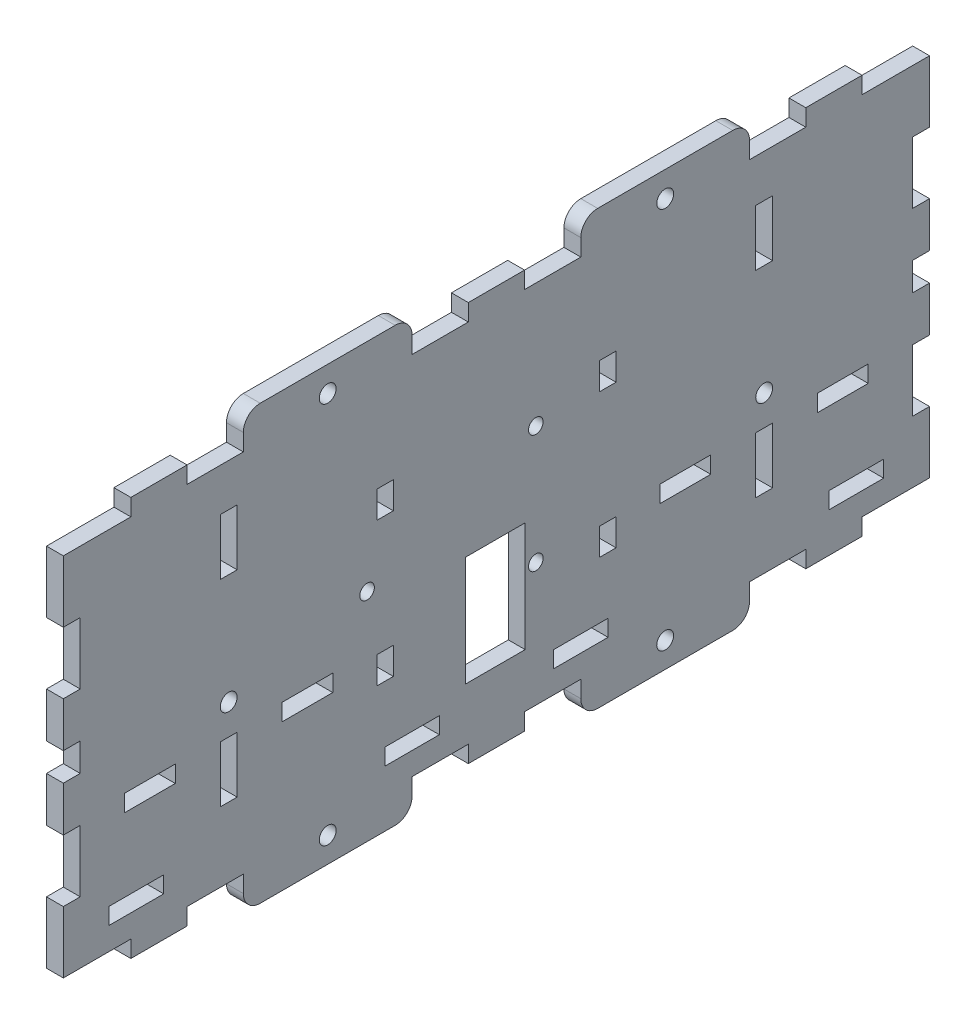
from build123d import *

# Parameters (mm, degrees)
CROQUIS1_W               = 154
CROQUIS1_H               = 71
SALIENTE_EXTRUIR1_DEPTH  = 1.5
CROQUIS2_W               = 12
CROQUIS2_H               = 3
CROQUIS2_W_2             = 10
CROQUIS2_W_3             = 3
CROQUIS2_H_2             = 11
CROQUIS2_H_3             = 5
CORTAR_EXTRUIR1_DEPTH    = 13
CROQUIS4_W               = 30
CROQUIS4_H               = 3
SALIENTE_EXTRUIR3_DEPTH  = 3
REDONDEO2_R              = 3
CROQUIS5_R               = 1.5
CORTAR_EXTRUIR2_DEPTH    = 3
REDONDEO2_OF_SIMETR_A4_R = 3
SIMETR_A5_START          = -2
SIMETR_A5_OUTLINE_R      = 1.5
SIMETR_A5_DEPTH          = 4
SIMETR_A5_START_2        = -1.5
SIMETR_A5_2_DEPTH        = 3
CROQUIS6_W               = 3
CROQUIS6_H               = 10
CROQUIS6_W_2             = 9.7
CROQUIS6_H_2             = 2.94
CROQUIS6_W_3             = 10.628979849
CROQUIS6_H_3             = 19.526562675
CORTAR_EXTRUIR3_DEPTH    = 10
CROQUIS7_R               = 1.5
CORTAR_EXTRUIR4_DEPTH    = 10
CROQUIS8_W               = 9
CROQUIS8_H               = 3
CORTAR_EXTRUIR5_DEPTH    = 10
CROQUIS9_R               = 1.3
CORTAR_EXTRUIR6_DEPTH    = 10
CROQUIS10_W              = 2.94
CROQUIS10_H              = 4.8
CORTAR_EXTRUIR7_DEPTH    = 23


with BuildPart() as part:
    # Croquis1 → Saliente-Extruir1 (new, symmetric)
    with BuildSketch(Plane(origin=(0, 0, 0), x_dir=(0, 0, -1), z_dir=(1, 0, 0))):
        Rectangle(CROQUIS1_W, CROQUIS1_H)
    extrude(amount=SALIENTE_EXTRUIR1_DEPTH, both=True)

    # Croquis2 → Cortar-Extruir1 (cut)
    with BuildSketch(Plane(origin=(1.5, 0, 0), x_dir=(0, 0, -1), z_dir=(1, 0, 0))):
        with Locations((-71, 34)):
            Rectangle(CROQUIS2_W, CROQUIS2_H)
        with Locations((-50, 34)):
            Rectangle(CROQUIS2_W_2, CROQUIS2_H)
        with Locations((-10, 34)):
            Rectangle(CROQUIS2_W_2, CROQUIS2_H)
        with Locations((10, 34)):
            Rectangle(CROQUIS2_W_2, CROQUIS2_H)
        with Locations((50, 34)):
            Rectangle(CROQUIS2_W_2, CROQUIS2_H)
        with Locations((71, 34)):
            Rectangle(CROQUIS2_W, CROQUIS2_H)
        with Locations((50, -34)):
            Rectangle(CROQUIS2_W_2, CROQUIS2_H)
        with Locations((10, -34)):
            Rectangle(CROQUIS2_W_2, CROQUIS2_H)
        with Locations((-10, -34)):
            Rectangle(CROQUIS2_W_2, CROQUIS2_H)
        with Locations((-50, -34)):
            Rectangle(CROQUIS2_W_2, CROQUIS2_H)
        with Locations((-71, -34)):
            Rectangle(CROQUIS2_W, CROQUIS2_H)
        with Locations((71, -34)):
            Rectangle(CROQUIS2_W, CROQUIS2_H)
        with Locations((-75.5, -16)):
            Rectangle(CROQUIS2_W_3, CROQUIS2_H_2)
        with Locations((-75.5, 0)):
            Rectangle(CROQUIS2_W_3, CROQUIS2_H_3)
        with Locations((-75.5, 16)):
            Rectangle(CROQUIS2_W_3, CROQUIS2_H_2)
        with Locations((75.5, -16)):
            Rectangle(CROQUIS2_W_3, CROQUIS2_H_2)
        with Locations((75.5, 16)):
            Rectangle(CROQUIS2_W_3, CROQUIS2_H_2)
        with Locations((75.5, 0)):
            Rectangle(CROQUIS2_W_3, CROQUIS2_H_3)
    extrude(amount=-CORTAR_EXTRUIR1_DEPTH, mode=Mode.SUBTRACT)

    # Croquis4 → Saliente-Extruir3 (add)
    with BuildSketch(Plane(origin=(1.5, 0, 0), x_dir=(0, 0, -1), z_dir=(1, 0, 0))):
        with Locations((-30, 37)):
            Rectangle(CROQUIS4_W, CROQUIS4_H)
    saliente_extruir3 = extrude(amount=-SALIENTE_EXTRUIR3_DEPTH)

    # Redondeo2
    redondeo2_edges = [part.edges().sort_by_distance(p)[0] for p in [
        (0, 38.5, 45),
        (0, 38.5, 15),
    ]]
    fillet(redondeo2_edges, radius=REDONDEO2_R)

    # Croquis5 → Cortar-Extruir2 (cut)
    with BuildSketch(Plane(origin=(1.5, 0, 0), x_dir=(0, 0, -1), z_dir=(1, 0, 0))):
        with Locations((-30, 34)):
            Circle(CROQUIS5_R)
    cortar_extruir2 = extrude(amount=-CORTAR_EXTRUIR2_DEPTH, mode=Mode.SUBTRACT)

    # Simetría4: Saliente-Extruir3, Cortar-Extruir2 across plane
    add(saliente_extruir3.mirror(Plane.ZX))
    add(cortar_extruir2.mirror(Plane.ZX), mode=Mode.SUBTRACT)

    # Redondeo2 of Simetría4
    redondeo2_of_simetr_a4_edges = [part.edges().sort_by_distance(p)[0] for p in [
        (0, -38.5, 45),
        (0, -38.5, 15),
    ]]
    fillet(redondeo2_of_simetr_a4_edges, radius=REDONDEO2_OF_SIMETR_A4_R)

    # Simetría5: read off the stored shape, not the designer's step
    # Simetría5 outline → Simetría5 (cut)
    with BuildSketch(Plane.YZ.offset(SIMETR_A5_START)):
        with Locations((34, -30)):
            Circle(SIMETR_A5_OUTLINE_R)
        with Locations((-34, -30)):
            Circle(SIMETR_A5_OUTLINE_R)
    extrude(amount=SIMETR_A5_DEPTH, mode=Mode.SUBTRACT)

    # Simetr_a5 2 outline → Simetr_a5 2 (add)
    with BuildSketch(Plane.YZ.offset(SIMETR_A5_START_2)):
        with BuildLine():
            Line((38.5, -42), (38.5, -18))
            ThreePointArc((38.5, -18), (37.621320344, -15.878679656), (35.5, -15))
            Line((35.5, -15), (35.5, -45))
            ThreePointArc((35.5, -45), (37.621320344, -44.121320344), (38.5, -42))
        make_face()
        with BuildLine():
            ThreePointArc((-35.5, -15), (-37.621320344, -15.878679656), (-38.5, -18))
            Line((-38.5, -18), (-38.5, -42))
            ThreePointArc((-38.5, -42), (-37.621320344, -44.121320344), (-35.5, -45))
            Line((-35.5, -45), (-35.5, -15))
        make_face()
    extrude(amount=SIMETR_A5_2_DEPTH)

    # Croquis6 → Cortar-Extruir3 (cut)
    with BuildSketch(Plane.ZY.offset(1.5)):
        with Locations((47.6, -15.1)):
            Rectangle(CROQUIS6_W, CROQUIS6_H)
        with Locations((47.6, 19.9)):
            Rectangle(CROQUIS6_W, CROQUIS6_H)
        with Locations((-47.6, -15.1)):
            Rectangle(CROQUIS6_W, CROQUIS6_H)
        with Locations((-47.6, 19.9)):
            Rectangle(CROQUIS6_W, CROQUIS6_H)
        with Locations((15, -27)):
            Rectangle(CROQUIS6_W_2, CROQUIS6_H_2)
        with Locations((64, -27)):
            Rectangle(CROQUIS6_W_2, CROQUIS6_H_2)
        with Locations((-64, -27)):
            Rectangle(CROQUIS6_W_2, CROQUIS6_H_2)
        with Locations((-15, -27)):
            Rectangle(CROQUIS6_W_2, CROQUIS6_H_2)
        with Locations((0.209178282, -13.227366202)):
            Rectangle(CROQUIS6_W_3, CROQUIS6_H_3)
    extrude(amount=-CORTAR_EXTRUIR3_DEPTH, mode=Mode.SUBTRACT)

    # Croquis7 → Cortar-Extruir4 (cut)
    with BuildSketch(Plane(origin=(1.5, 0, 0), x_dir=(0, 0, -1), z_dir=(1, 0, 0))):
        with Locations((-47.6, -4.7)):
            Circle(CROQUIS7_R)
        with Locations(Location((47.6, -4.7, 0), (0, 0, 180))):
            Circle(CROQUIS7_R)
    extrude(amount=-CORTAR_EXTRUIR4_DEPTH, mode=Mode.SUBTRACT)

    # Croquis8 → Cortar-Extruir5 (cut)
    with BuildSketch(Plane.ZY.offset(1.5)):
        with Locations((-33.6, -11)):
            Rectangle(CROQUIS8_W, CROQUIS8_H)
        with Locations((-61.6, -11)):
            Rectangle(CROQUIS8_W, CROQUIS8_H)
        with Locations((33.6, -11)):
            Rectangle(CROQUIS8_W, CROQUIS8_H)
        with Locations((61.6, -11)):
            Rectangle(CROQUIS8_W, CROQUIS8_H)
    extrude(amount=-CORTAR_EXTRUIR5_DEPTH, mode=Mode.SUBTRACT)

    # Croquis9 → Cortar-Extruir6 (cut)
    with BuildSketch(Plane(origin=(1.5, 0, 0), x_dir=(0, 0, -1), z_dir=(1, 0, 0))):
        with Locations((-23, 0)):
            Circle(CROQUIS9_R)
        with Locations((7, 10.5)):
            Circle(CROQUIS9_R)
        with Locations((7, -10.5)):
            Circle(CROQUIS9_R)
    extrude(amount=-CORTAR_EXTRUIR6_DEPTH, mode=Mode.SUBTRACT)

    # Croquis10 → Cortar-Extruir7 (cut)
    with BuildSketch(Plane.ZY.offset(1.5)):
        with Locations((-19.8, 12.5)):
            Rectangle(CROQUIS10_W, CROQUIS10_H)
        with Locations((-19.8, -13)):
            Rectangle(CROQUIS10_W, CROQUIS10_H)
        with Locations((19.8, 12.5)):
            Rectangle(CROQUIS10_W, CROQUIS10_H)
        with Locations((19.8, -13)):
            Rectangle(CROQUIS10_W, CROQUIS10_H)
    extrude(amount=-CORTAR_EXTRUIR7_DEPTH, mode=Mode.SUBTRACT)


solid = part.part
